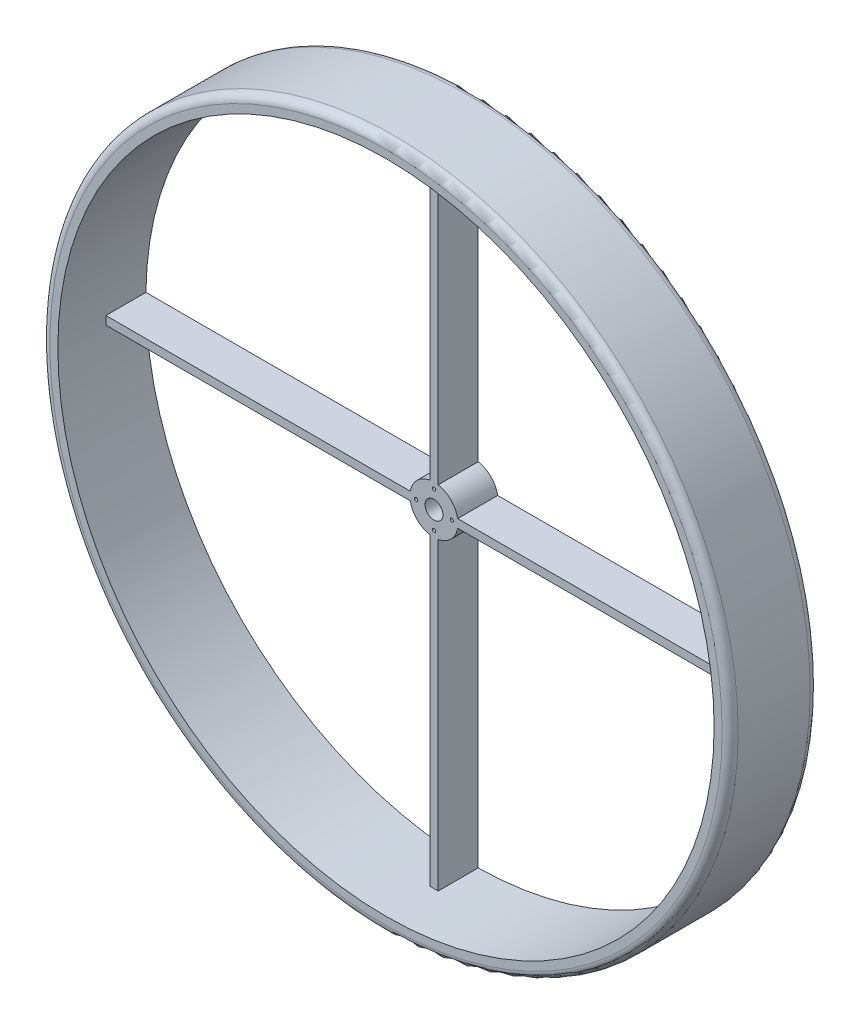
from build123d import *

# Parameters (mm, degrees)
BOSS_EXTRUDE1_DEPTH      = 50
BOSS_EXTRUDE1_DEPTH_BACK = 5
SKETCH2_R                = 215
SKETCH2_R_2              = 205
BOSS_EXTRUDE2_DEPTH      = 20
BOSS_EXTRUDE2_DEPTH_BACK = 5
SKETCH3_R                = 1
FILLET1_R                = 5
FILLET2_R                = 5
SCALE1_SCALE             = 0.625


with BuildPart() as part:
    # Sketch2 → Boss-Extrude1 (new, two sides: drawn at the far end of the back side and taken through both)
    with BuildSketch(Plane.XY.offset(-BOSS_EXTRUDE1_DEPTH_BACK)):
        Circle(SKETCH2_R)
        Circle(SKETCH2_R_2, mode=Mode.SUBTRACT)
    extrude(amount=BOSS_EXTRUDE1_DEPTH + BOSS_EXTRUDE1_DEPTH_BACK)

    # Sketch3 → Boss-Extrude2 (add, two sides: drawn at the far end of the back side and taken through both)
    with BuildSketch(Plane.XY.offset(-BOSS_EXTRUDE2_DEPTH_BACK)):
        with BuildLine():
            Line((210.976119612, 2.604722665), (14.772116295, 2.604722665))
            ThreePointArc((14.772116295, 2.604722665), (10.606601718, 10.606601718), (2.604722665, 14.772116295))
            Line((2.604722665, 14.772116295), (2.604722665, 210.976119612))
            Line((2.604722665, 210.976119612), (-2.604722665, 210.976119612))
            Line((-2.604722665, 210.976119612), (-2.604722665, 14.772116295))
            ThreePointArc((-2.604722665, 14.772116295), (-10.606601718, 10.606601718), (-14.772116295, 2.604722665))
            Line((-14.772116295, 2.604722665), (-210.976119612, 2.604722665))
            Line((-210.976119612, 2.604722665), (-210.976119612, -2.604722665))
            Line((-210.976119612, -2.604722665), (-14.772116295, -2.604722665))
            ThreePointArc((-14.772116295, -2.604722665), (-10.606601718, -10.606601718), (-2.604722665, -14.772116295))
            Line((-2.604722665, -14.772116295), (-2.604722665, -210.976119612))
            Line((-2.604722665, -210.976119612), (2.604722665, -210.976119612))
            Line((2.604722665, -210.976119612), (2.604722665, -14.772116295))
            ThreePointArc((2.604722665, -14.772116295), (10.606601718, -10.606601718), (14.772116295, -2.604722665))
            Line((14.772116295, -2.604722665), (210.976119612, -2.604722665))
            Line((210.976119612, -2.604722665), (210.976119612, 2.604722665))
        make_face()
        with Locations((0, -11.2)):
            Circle(SKETCH3_R, mode=Mode.SUBTRACT)
        with Locations((-11.2, 0)):
            Circle(SKETCH3_R, mode=Mode.SUBTRACT)
        with BuildLine():
            ThreePointArc((-5.514923417, -0.972429795), (-5.6, 0), (-5.514923417, 0.972429795))
            ThreePointArc((-5.514923417, 0.972429795), (-3.959797975, 3.959797975), (-0.972429795, 5.514923417))
            ThreePointArc((-0.972429795, 5.514923417), (0, 5.6), (0.972429795, 5.514923417))
            ThreePointArc((0.972429795, 5.514923417), (3.959797975, 3.959797975), (5.514923417, 0.972429795))
            ThreePointArc((5.514923417, 0.972429795), (5.578690309, 0.488072159), (5.6, 0))
            ThreePointArc((5.6, 0), (5.578690309, -0.488072159), (5.514923417, -0.972429795))
            ThreePointArc((5.514923417, -0.972429795), (3.959797975, -3.959797975), (0.972429795, -5.514923417))
            ThreePointArc((0.972429795, -5.514923417), (0, -5.6), (-0.972429795, -5.514923417))
            ThreePointArc((-0.972429795, -5.514923417), (-3.959797975, -3.959797975), (-5.514923417, -0.972429795))
        make_face(mode=Mode.SUBTRACT)
        with Locations((11.2, 0)):
            Circle(SKETCH3_R, mode=Mode.SUBTRACT)
        with Locations((0, 11.2)):
            Circle(SKETCH3_R, mode=Mode.SUBTRACT)
    extrude(amount=BOSS_EXTRUDE2_DEPTH + BOSS_EXTRUDE2_DEPTH_BACK)

    # Fillet1
    fillet1_edges = [part.edges().sort_by_distance(p)[0] for p in [
        (-215, 0, 50),
    ]]
    fillet(fillet1_edges, radius=FILLET1_R)

    # Fillet2
    # the kernel refuses this fillet: 5 mm, written as the material it takes off along each edge
    with BuildSketch(Plane(origin=(0, 0, -5), x_dir=(1, 0, 0), z_dir=(0, -1, 0))) as fillet2_piece_1:
        with BuildLine():
            CenterArc((215 - FILLET2_R, FILLET2_R), FILLET2_R, 270, 90)
            Line((215 - FILLET2_R, 0), (215, 0))
            Line((215, 0), (215, FILLET2_R))
        make_face()
    revolve(axis=Axis((0, 0, -5), (0, 0, 1)), mode=Mode.SUBTRACT)


with BuildPart() as part_1:
    # Scale1: scaled about (0, 0, 0)
    add(part.part.scale(SCALE1_SCALE))


solid = part_1.part
